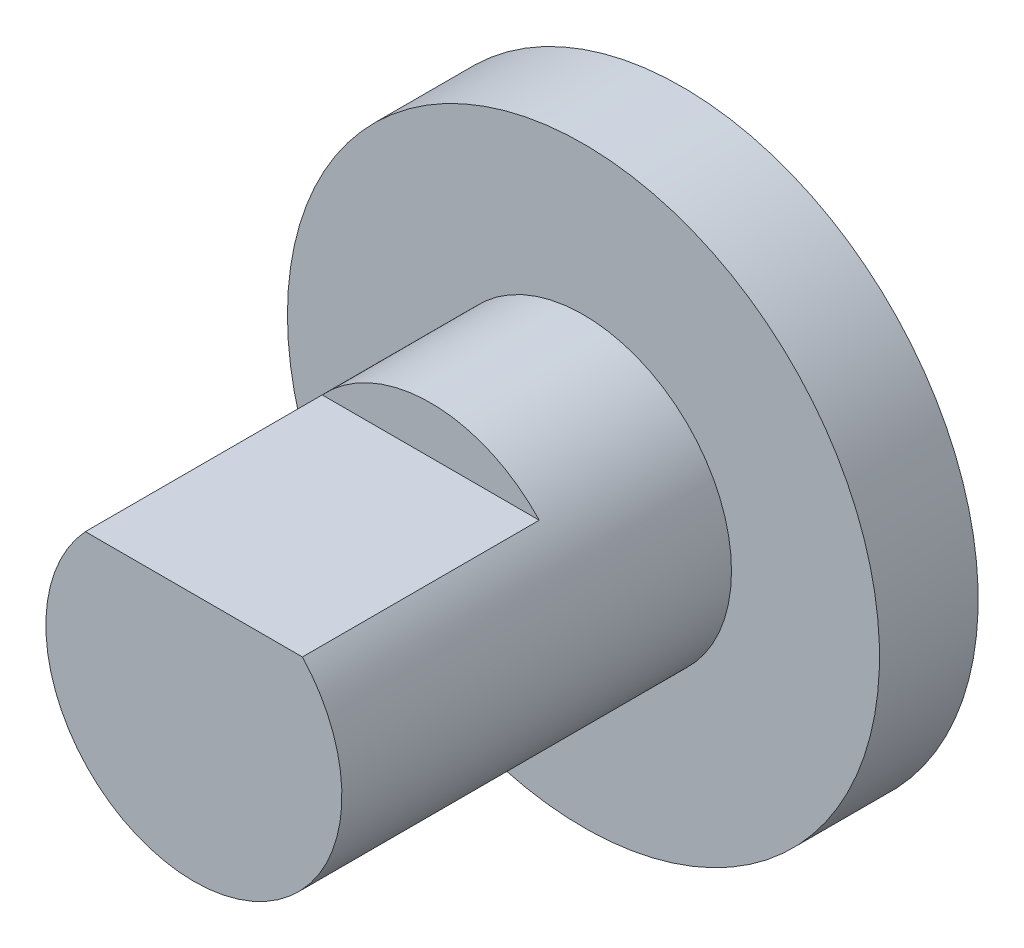
from build123d import *

# Parameters (mm, degrees)
SKETCH1_R           = 7.5
BOSS_EXTRUDE1_DEPTH = 19.74
SKETCH2_R           = 15
BOSS_EXTRUDE2_DEPTH = 5
CUT_EXTRUDE1_START  = -12
CUT_EXTRUDE1_DEPTH  = 12


with BuildPart() as part:
    # Sketch1 → Boss-Extrude1 (new body)
    with BuildSketch(Plane.XY):
        Circle(SKETCH1_R)
    extrude(amount=BOSS_EXTRUDE1_DEPTH)

    # Sketch2 → Boss-Extrude2 (add)
    with BuildSketch(Plane(origin=(0, 0, 0), x_dir=(-1, 0, 0), z_dir=(0, 0, -1))):
        Circle(SKETCH2_R)
    extrude(amount=BOSS_EXTRUDE2_DEPTH)

    # Sketch3 → Cut-Extrude1 (cut)
    with BuildSketch(Plane.XY.offset(19.74).offset(CUT_EXTRUDE1_START)):
        with BuildLine():
            Line((-5.499090834, 5.1), (5.499090834, 5.1))
            ThreePointArc((5.499090834, 5.1), (0, 7.5), (-5.499090834, 5.1))
        make_face()
    extrude(amount=CUT_EXTRUDE1_DEPTH, mode=Mode.SUBTRACT)


solid = part.part
